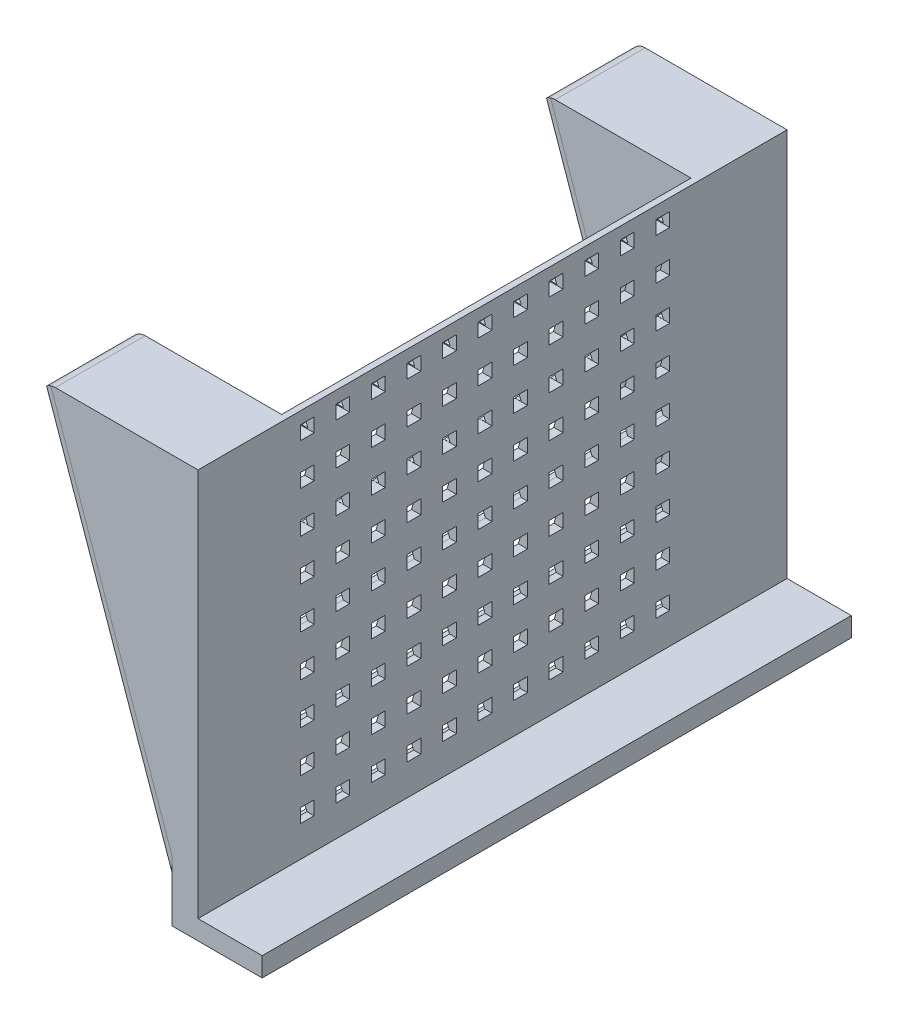
from build123d import *

# Parameters (mm, degrees)
SKETCH1_W           = 65.455015422
SKETCH1_H           = 426.283323678
BOSS_EXTRUDE1_DEPTH = 14
SKETCH2_W           = 296.283323678
SKETCH2_H           = 281.187039655
BOSS_EXTRUDE2_DEPTH = 9
CUT_EXTRUDE1_DEPTH  = 301
SKETCH4_W           = 10
SKETCH4_H           = 10
CUT_EXTRUDE2_DEPTH  = 20
BOSS_EXTRUDE3_DEPTH = 65
FILLET1_R           = 10
BOSS_EXTRUDE4_DEPTH = 65
FILLET2_R           = 10


with BuildPart() as part:
    # Sketch1 → Boss-Extrude1 (new body)
    with BuildSketch(Plane.XZ.offset(-2205.344281495)):
        with Locations((2748.549131836, 976.083854875)):
            Rectangle(SKETCH1_W, SKETCH1_H)
    extrude(amount=BOSS_EXTRUDE1_DEPTH)

    # Sketch2 → Boss-Extrude2 (add)
    with BuildSketch(Plane.ZY.offset(-2725.821624125)):
        with Locations((976.083854875, 2345.937801323)):
            Rectangle(SKETCH2_W, SKETCH2_H)
    extrude(amount=-BOSS_EXTRUDE2_DEPTH)

    # Sketch3 → Cut-Extrude1 (cut)
    with BuildSketch(Plane.XY.offset(1124.225516714)):
        Polygon((2730.321624125, 2405.73132115), (2725.821624125, 2405.73132115), (2725.821624125, 2387.691998559), (2730.321624125, 2387.691998559), (2727.297306391, 2395.09100795), align=None)
        Polygon((2730.321624125, 2425.93132115), (2725.821624125, 2425.93132115), (2725.821624125, 2407.891998559), (2730.321624125, 2407.891998559), (2727.297306391, 2415.29100795), align=None)
        Polygon((2730.321624125, 2446.13132115), (2725.821624125, 2446.13132115), (2725.821624125, 2428.091998559), (2730.321624125, 2428.091998559), (2727.297306391, 2435.49100795), align=None)
        Polygon((2730.321624125, 2466.33132115), (2725.821624125, 2466.33132115), (2725.821624125, 2448.291998559), (2730.321624125, 2448.291998559), (2727.297306391, 2455.69100795), align=None)
        Polygon((2727.297306391, 2475.89100795), (2730.321624125, 2486.53132115), (2725.821624125, 2486.53132115), (2725.821624125, 2468.491998559), (2730.321624125, 2468.491998559), align=None)
        Polygon((2730.321624125, 2385.53132115), (2725.821624125, 2385.53132115), (2725.821624125, 2367.491998559), (2730.321624125, 2367.491998559), (2727.297306391, 2374.89100795), align=None)
        Polygon((2730.321624125, 2365.33132115), (2725.821624125, 2365.33132115), (2725.821624125, 2347.291998559), (2730.321624125, 2347.291998559), (2727.297306391, 2354.69100795), align=None)
        Polygon((2730.321624125, 2345.13132115), (2725.821624125, 2345.13132115), (2725.821624125, 2327.091998559), (2730.321624125, 2327.091998559), (2727.297306391, 2334.49100795), align=None)
        Polygon((2730.321624125, 2324.93132115), (2725.821624125, 2324.93132115), (2725.821624125, 2306.891998559), (2730.321624125, 2306.891998559), (2727.297306391, 2314.29100795), align=None)
        Polygon((2730.321624125, 2304.73132115), (2725.821624125, 2304.73132115), (2725.821624125, 2286.691998559), (2730.321624125, 2286.691998559), (2727.297306391, 2294.09100795), align=None)
        Polygon((2730.321624125, 2284.53132115), (2725.821624125, 2284.53132115), (2725.821624125, 2266.491998559), (2730.321624125, 2266.491998559), (2727.297306391, 2273.89100795), align=None)
        Polygon((2730.321624125, 2264.33132115), (2725.821624125, 2264.33132115), (2725.821624125, 2246.291998559), (2730.321624125, 2246.291998559), (2727.297306391, 2253.69100795), align=None)
        Polygon((2730.321624125, 2244.13132115), (2725.821624125, 2244.13132115), (2725.821624125, 2226.091998559), (2730.321624125, 2226.091998559), (2727.297306391, 2233.49100795), align=None)
        Polygon((2730.321624125, 2223.93132115), (2725.821624125, 2223.93132115), (2725.821624125, 2205.891998559), (2730.321624125, 2205.891998559), (2727.297306391, 2213.29100795), align=None)
    extrude(amount=-CUT_EXTRUDE1_DEPTH, mode=Mode.SUBTRACT)

    # Sketch4 → Cut-Extrude2 (cut)
    with BuildSketch(Plane(origin=(2734.821624125, 0, 0), x_dir=(0, 0, -1), z_dir=(1, 0, 0))):
        with Locations((-1084.484396727, 2472.786072392)):
            Rectangle(SKETCH4_W, SKETCH4_H)
        with Locations((-1110.218258485, 2472.786072392)):
            Rectangle(SKETCH4_W, SKETCH4_H)
        with Locations((-1058.75053497, 2472.786072392)):
            Rectangle(SKETCH4_W, SKETCH4_H)
        with Locations((-1033.016673212, 2472.786072392)):
            Rectangle(SKETCH4_W, SKETCH4_H)
        with Locations((-1007.282811455, 2472.786072392)):
            Rectangle(SKETCH4_W, SKETCH4_H)
        with Locations((-981.548949697, 2472.786072392)):
            Rectangle(SKETCH4_W, SKETCH4_H)
        with Locations((-955.81508794, 2472.786072392)):
            Rectangle(SKETCH4_W, SKETCH4_H)
        with Locations((-930.081226183, 2472.786072392)):
            Rectangle(SKETCH4_W, SKETCH4_H)
        with Locations((-904.347364425, 2472.786072392)):
            Rectangle(SKETCH4_W, SKETCH4_H)
        with Locations((-878.613502668, 2472.786072392)):
            Rectangle(SKETCH4_W, SKETCH4_H)
        with Locations((-852.87964091, 2472.786072392)):
            Rectangle(SKETCH4_W, SKETCH4_H)
        with Locations((-1084.484396727, 2442.786072392)):
            Rectangle(SKETCH4_W, SKETCH4_H)
        with Locations((-1110.218258485, 2442.786072392)):
            Rectangle(SKETCH4_W, SKETCH4_H)
        with Locations((-1058.75053497, 2442.786072392)):
            Rectangle(SKETCH4_W, SKETCH4_H)
        with Locations((-1033.016673212, 2442.786072392)):
            Rectangle(SKETCH4_W, SKETCH4_H)
        with Locations((-1007.282811455, 2442.786072392)):
            Rectangle(SKETCH4_W, SKETCH4_H)
        with Locations((-981.548949697, 2442.786072392)):
            Rectangle(SKETCH4_W, SKETCH4_H)
        with Locations((-955.81508794, 2442.786072392)):
            Rectangle(SKETCH4_W, SKETCH4_H)
        with Locations((-930.081226183, 2442.786072392)):
            Rectangle(SKETCH4_W, SKETCH4_H)
        with Locations((-904.347364425, 2442.786072392)):
            Rectangle(SKETCH4_W, SKETCH4_H)
        with Locations((-878.613502668, 2442.786072392)):
            Rectangle(SKETCH4_W, SKETCH4_H)
        with Locations((-852.87964091, 2442.786072392)):
            Rectangle(SKETCH4_W, SKETCH4_H)
        with Locations((-1084.484396727, 2412.786072392)):
            Rectangle(SKETCH4_W, SKETCH4_H)
        with Locations((-1110.218258485, 2412.786072392)):
            Rectangle(SKETCH4_W, SKETCH4_H)
        with Locations((-1058.75053497, 2412.786072392)):
            Rectangle(SKETCH4_W, SKETCH4_H)
        with Locations((-1033.016673212, 2412.786072392)):
            Rectangle(SKETCH4_W, SKETCH4_H)
        with Locations((-1007.282811455, 2412.786072392)):
            Rectangle(SKETCH4_W, SKETCH4_H)
        with Locations((-981.548949697, 2412.786072392)):
            Rectangle(SKETCH4_W, SKETCH4_H)
        with Locations((-955.81508794, 2412.786072392)):
            Rectangle(SKETCH4_W, SKETCH4_H)
        with Locations((-930.081226183, 2412.786072392)):
            Rectangle(SKETCH4_W, SKETCH4_H)
        with Locations((-904.347364425, 2412.786072392)):
            Rectangle(SKETCH4_W, SKETCH4_H)
        with Locations((-878.613502668, 2412.786072392)):
            Rectangle(SKETCH4_W, SKETCH4_H)
        with Locations((-852.87964091, 2412.786072392)):
            Rectangle(SKETCH4_W, SKETCH4_H)
        with Locations((-1084.484396727, 2382.786072392)):
            Rectangle(SKETCH4_W, SKETCH4_H)
        with Locations((-1110.218258485, 2382.786072392)):
            Rectangle(SKETCH4_W, SKETCH4_H)
        with Locations((-1058.75053497, 2382.786072392)):
            Rectangle(SKETCH4_W, SKETCH4_H)
        with Locations((-1033.016673212, 2382.786072392)):
            Rectangle(SKETCH4_W, SKETCH4_H)
        with Locations((-1007.282811455, 2382.786072392)):
            Rectangle(SKETCH4_W, SKETCH4_H)
        with Locations((-981.548949697, 2382.786072392)):
            Rectangle(SKETCH4_W, SKETCH4_H)
        with Locations((-955.81508794, 2382.786072392)):
            Rectangle(SKETCH4_W, SKETCH4_H)
        with Locations((-930.081226183, 2382.786072392)):
            Rectangle(SKETCH4_W, SKETCH4_H)
        with Locations((-904.347364425, 2382.786072392)):
            Rectangle(SKETCH4_W, SKETCH4_H)
        with Locations((-878.613502668, 2382.786072392)):
            Rectangle(SKETCH4_W, SKETCH4_H)
        with Locations((-852.87964091, 2382.786072392)):
            Rectangle(SKETCH4_W, SKETCH4_H)
        with Locations((-1084.484396727, 2352.786072392)):
            Rectangle(SKETCH4_W, SKETCH4_H)
        with Locations((-1110.218258485, 2352.786072392)):
            Rectangle(SKETCH4_W, SKETCH4_H)
        with Locations((-1058.75053497, 2352.786072392)):
            Rectangle(SKETCH4_W, SKETCH4_H)
        with Locations((-1033.016673212, 2352.786072392)):
            Rectangle(SKETCH4_W, SKETCH4_H)
        with Locations((-1007.282811455, 2352.786072392)):
            Rectangle(SKETCH4_W, SKETCH4_H)
        with Locations((-981.548949697, 2352.786072392)):
            Rectangle(SKETCH4_W, SKETCH4_H)
        with Locations((-955.81508794, 2352.786072392)):
            Rectangle(SKETCH4_W, SKETCH4_H)
        with Locations((-930.081226183, 2352.786072392)):
            Rectangle(SKETCH4_W, SKETCH4_H)
        with Locations((-904.347364425, 2352.786072392)):
            Rectangle(SKETCH4_W, SKETCH4_H)
        with Locations((-878.613502668, 2352.786072392)):
            Rectangle(SKETCH4_W, SKETCH4_H)
        with Locations((-852.87964091, 2352.786072392)):
            Rectangle(SKETCH4_W, SKETCH4_H)
        with Locations((-1084.484396727, 2322.786072392)):
            Rectangle(SKETCH4_W, SKETCH4_H)
        with Locations((-1110.218258485, 2322.786072392)):
            Rectangle(SKETCH4_W, SKETCH4_H)
        with Locations((-1058.75053497, 2322.786072392)):
            Rectangle(SKETCH4_W, SKETCH4_H)
        with Locations((-1033.016673212, 2322.786072392)):
            Rectangle(SKETCH4_W, SKETCH4_H)
        with Locations((-1007.282811455, 2322.786072392)):
            Rectangle(SKETCH4_W, SKETCH4_H)
        with Locations((-981.548949697, 2322.786072392)):
            Rectangle(SKETCH4_W, SKETCH4_H)
        with Locations((-955.81508794, 2322.786072392)):
            Rectangle(SKETCH4_W, SKETCH4_H)
        with Locations((-930.081226183, 2322.786072392)):
            Rectangle(SKETCH4_W, SKETCH4_H)
        with Locations((-904.347364425, 2322.786072392)):
            Rectangle(SKETCH4_W, SKETCH4_H)
        with Locations((-878.613502668, 2322.786072392)):
            Rectangle(SKETCH4_W, SKETCH4_H)
        with Locations((-852.87964091, 2322.786072392)):
            Rectangle(SKETCH4_W, SKETCH4_H)
        with Locations((-1084.484396727, 2292.786072392)):
            Rectangle(SKETCH4_W, SKETCH4_H)
        with Locations((-1110.218258485, 2292.786072392)):
            Rectangle(SKETCH4_W, SKETCH4_H)
        with Locations((-1058.75053497, 2292.786072392)):
            Rectangle(SKETCH4_W, SKETCH4_H)
        with Locations((-1033.016673212, 2292.786072392)):
            Rectangle(SKETCH4_W, SKETCH4_H)
        with Locations((-1007.282811455, 2292.786072392)):
            Rectangle(SKETCH4_W, SKETCH4_H)
        with Locations((-981.548949697, 2292.786072392)):
            Rectangle(SKETCH4_W, SKETCH4_H)
        with Locations((-955.81508794, 2292.786072392)):
            Rectangle(SKETCH4_W, SKETCH4_H)
        with Locations((-930.081226183, 2292.786072392)):
            Rectangle(SKETCH4_W, SKETCH4_H)
        with Locations((-904.347364425, 2292.786072392)):
            Rectangle(SKETCH4_W, SKETCH4_H)
        with Locations((-878.613502668, 2292.786072392)):
            Rectangle(SKETCH4_W, SKETCH4_H)
        with Locations((-852.87964091, 2292.786072392)):
            Rectangle(SKETCH4_W, SKETCH4_H)
        with Locations((-1084.484396727, 2262.786072392)):
            Rectangle(SKETCH4_W, SKETCH4_H)
        with Locations((-1110.218258485, 2262.786072392)):
            Rectangle(SKETCH4_W, SKETCH4_H)
        with Locations((-1058.75053497, 2262.786072392)):
            Rectangle(SKETCH4_W, SKETCH4_H)
        with Locations((-1033.016673212, 2262.786072392)):
            Rectangle(SKETCH4_W, SKETCH4_H)
        with Locations((-1007.282811455, 2262.786072392)):
            Rectangle(SKETCH4_W, SKETCH4_H)
        with Locations((-981.548949697, 2262.786072392)):
            Rectangle(SKETCH4_W, SKETCH4_H)
        with Locations((-955.81508794, 2262.786072392)):
            Rectangle(SKETCH4_W, SKETCH4_H)
        with Locations((-930.081226183, 2262.786072392)):
            Rectangle(SKETCH4_W, SKETCH4_H)
        with Locations((-904.347364425, 2262.786072392)):
            Rectangle(SKETCH4_W, SKETCH4_H)
        with Locations((-878.613502668, 2262.786072392)):
            Rectangle(SKETCH4_W, SKETCH4_H)
        with Locations((-852.87964091, 2262.786072392)):
            Rectangle(SKETCH4_W, SKETCH4_H)
        with Locations((-1084.484396727, 2232.786072392)):
            Rectangle(SKETCH4_W, SKETCH4_H)
        with Locations((-1110.218258485, 2232.786072392)):
            Rectangle(SKETCH4_W, SKETCH4_H)
        with Locations((-1058.75053497, 2232.786072392)):
            Rectangle(SKETCH4_W, SKETCH4_H)
        with Locations((-1033.016673212, 2232.786072392)):
            Rectangle(SKETCH4_W, SKETCH4_H)
        with Locations((-1007.282811455, 2232.786072392)):
            Rectangle(SKETCH4_W, SKETCH4_H)
        with Locations((-981.548949697, 2232.786072392)):
            Rectangle(SKETCH4_W, SKETCH4_H)
        with Locations((-955.81508794, 2232.786072392)):
            Rectangle(SKETCH4_W, SKETCH4_H)
        with Locations((-930.081226183, 2232.786072392)):
            Rectangle(SKETCH4_W, SKETCH4_H)
        with Locations((-904.347364425, 2232.786072392)):
            Rectangle(SKETCH4_W, SKETCH4_H)
        with Locations((-878.613502668, 2232.786072392)):
            Rectangle(SKETCH4_W, SKETCH4_H)
        with Locations((-852.87964091, 2232.786072392)):
            Rectangle(SKETCH4_W, SKETCH4_H)
    extrude(amount=-CUT_EXTRUDE2_DEPTH, mode=Mode.SUBTRACT)

    # Sketch5 → Boss-Extrude3 (add)
    with BuildSketch(Plane.XY.offset(1124.225516714)):
        Polygon((2734.821624125, 2486.53132115), (2734.821624125, 2205.344281495), (2715.821624125, 2205.344281495), (2617.550474141, 2486.53132115), align=None)
    extrude(amount=BOSS_EXTRUDE3_DEPTH)

    # Fillet1
    # the kernel refuses this fillet: 10 mm, written as the material it takes off along each edge
    with BuildSketch(Plane(origin=(2724.069593349, 2181.744048367, 1189.225516714), x_dir=(0.9440093251022348, 0.3299187689720354, -4.547473508864564e-14), z_dir=(-0.3299187689720354, 0.9440093251022348, 0))) as fillet1_piece_1_section:
        with BuildLine():
            CenterArc((FILLET1_R, FILLET1_R), FILLET1_R, 180, 90)
            Line((0, FILLET1_R), (0, 0))
            Line((0, 0), (FILLET1_R, 0))
        make_face()
    fillet1_piece_1 = extrude(amount=347.86468436, mode=Mode.PRIVATE)
    fillet1_piece_1 = split(fillet1_piece_1, bisect_by=Plane(origin=(2715.821624125, 2181.744048367, 1189.225516714), z_dir=(-1, 0, 0)), keep=Keep.TOP, mode=Mode.PRIVATE)
    add(fillet1_piece_1, mode=Mode.SUBTRACT)
    with BuildSketch(Plane(origin=(2724.069593349, 2181.744048367, 1124.225516714), x_dir=(0, 0, 1), z_dir=(-0.3299187689720354, 0.9440093251022348, 0))) as fillet1_piece_2_section:
        with BuildLine():
            CenterArc((FILLET1_R, FILLET1_R), FILLET1_R, 180, 90)
            Line((0, FILLET1_R), (0, 0))
            Line((0, 0), (FILLET1_R, 0))
        make_face()
    fillet1_piece_2 = extrude(amount=347.86468436, mode=Mode.PRIVATE)
    fillet1_piece_2 = split(fillet1_piece_2, bisect_by=Plane(origin=(2715.821624125, 2181.744048367, 1124.225516714), z_dir=(1, 0, 0)), keep=Keep.TOP, mode=Mode.PRIVATE)
    fillet1_piece_2 = split(fillet1_piece_2, bisect_by=Plane(origin=(2725.821624125, 2181.744048367, 1124.225516714), z_dir=(-1, 0, 0)), keep=Keep.TOP, mode=Mode.PRIVATE)
    fillet1_piece_2 = split(fillet1_piece_2, bisect_by=Plane(origin=(2724.069593349, 2205.891998559, 1124.225516714), z_dir=(0, -1, 0)), keep=Keep.TOP, mode=Mode.PRIVATE)
    fillet1_piece_2 = split(fillet1_piece_2, bisect_by=Plane(origin=(2724.069593349, 2205.344281495, 1124.225516714), z_dir=(0, 1, 0)), keep=Keep.TOP, mode=Mode.PRIVATE)
    add(fillet1_piece_2, mode=Mode.SUBTRACT)
    with BuildSketch(Plane(origin=(2724.069593349, 2181.744048367, 1124.225516714), x_dir=(0, 0, 1), z_dir=(-0.3299187689720354, 0.9440093251022348, 0))) as fillet1_piece_3_section:
        with BuildLine():
            CenterArc((FILLET1_R, FILLET1_R), FILLET1_R, 180, 90)
            Line((0, FILLET1_R), (0, 0))
            Line((0, 0), (FILLET1_R, 0))
        make_face()
    fillet1_piece_3 = extrude(amount=347.86468436, mode=Mode.PRIVATE)
    fillet1_piece_3 = split(fillet1_piece_3, bisect_by=Plane(origin=(2715.821624125, 2181.744048367, 1124.225516714), z_dir=(1, 0, 0)), keep=Keep.TOP, mode=Mode.PRIVATE)
    fillet1_piece_3 = split(fillet1_piece_3, bisect_by=Plane(origin=(2725.821624125, 2181.744048367, 1124.225516714), z_dir=(-1, 0, 0)), keep=Keep.TOP, mode=Mode.PRIVATE)
    fillet1_piece_3 = split(fillet1_piece_3, bisect_by=Plane(origin=(2724.069593349, 2205.891998559, 1124.225516714), z_dir=(0, 1, 0)), keep=Keep.TOP, mode=Mode.PRIVATE)
    add(fillet1_piece_3, mode=Mode.SUBTRACT)
    with BuildSketch(Plane(origin=(2724.069593349, 2181.744048367, 1124.225516714), x_dir=(0, 0, 1), z_dir=(-0.3299187689720354, 0.9440093251022348, 0))) as fillet1_piece_4_section:
        with BuildLine():
            CenterArc((FILLET1_R, FILLET1_R), FILLET1_R, 180, 90)
            Line((0, FILLET1_R), (0, 0))
            Line((0, 0), (FILLET1_R, 0))
        make_face()
    fillet1_piece_4 = extrude(amount=347.86468436, mode=Mode.PRIVATE)
    fillet1_piece_4 = split(fillet1_piece_4, bisect_by=Plane(origin=(2715.821624125, 2181.744048367, 1124.225516714), z_dir=(-1, 0, 0)), keep=Keep.TOP, mode=Mode.PRIVATE)
    fillet1_piece_4 = split(fillet1_piece_4, bisect_by=Plane(origin=(2724.069593349, 2205.891998559, 1124.225516714), z_dir=(0, -1, 0)), keep=Keep.TOP, mode=Mode.PRIVATE)
    fillet1_piece_4 = split(fillet1_piece_4, bisect_by=Plane(origin=(2724.069593349, 2205.344281495, 1124.225516714), z_dir=(0, 1, 0)), keep=Keep.TOP, mode=Mode.PRIVATE)
    add(fillet1_piece_4, mode=Mode.SUBTRACT)
    with BuildSketch(Plane(origin=(2724.069593349, 2181.744048367, 1124.225516714), x_dir=(0, 0, 1), z_dir=(-0.3299187689720354, 0.9440093251022348, 0))) as fillet1_piece_5_section:
        with BuildLine():
            CenterArc((FILLET1_R, FILLET1_R), FILLET1_R, 180, 90)
            Line((0, FILLET1_R), (0, 0))
            Line((0, 0), (FILLET1_R, 0))
        make_face()
    fillet1_piece_5 = extrude(amount=347.86468436, mode=Mode.PRIVATE)
    fillet1_piece_5 = split(fillet1_piece_5, bisect_by=Plane(origin=(2725.821624125, 2181.744048367, 1124.225516714), z_dir=(1, 0, 0)), keep=Keep.TOP, mode=Mode.PRIVATE)
    fillet1_piece_5 = split(fillet1_piece_5, bisect_by=Plane(origin=(2724.069593349, 2205.891998559, 1124.225516714), z_dir=(0, 1, 0)), keep=Keep.TOP, mode=Mode.PRIVATE)
    add(fillet1_piece_5, mode=Mode.SUBTRACT)
    with BuildSketch(Plane(origin=(2724.069593349, 2181.744048367, 1124.225516714), x_dir=(0, 0, 1), z_dir=(-0.3299187689720354, 0.9440093251022348, 0))) as fillet1_piece_6_section:
        with BuildLine():
            CenterArc((FILLET1_R, FILLET1_R), FILLET1_R, 180, 90)
            Line((0, FILLET1_R), (0, 0))
            Line((0, 0), (FILLET1_R, 0))
        make_face()
    fillet1_piece_6 = extrude(amount=347.86468436, mode=Mode.PRIVATE)
    fillet1_piece_6 = split(fillet1_piece_6, bisect_by=Plane(origin=(2715.821624125, 2181.744048367, 1124.225516714), z_dir=(-1, 0, 0)), keep=Keep.TOP, mode=Mode.PRIVATE)
    fillet1_piece_6 = split(fillet1_piece_6, bisect_by=Plane(origin=(2724.069593349, 2205.891998559, 1124.225516714), z_dir=(0, 1, 0)), keep=Keep.TOP, mode=Mode.PRIVATE)
    add(fillet1_piece_6, mode=Mode.SUBTRACT)
    with BuildSketch(Plane(origin=(2617.550474141, 2486.53132115, 1089.005558245), x_dir=(0.3299187689720272, -0.9440093251022377, 0), z_dir=(0, 0, 1))) as fillet1_piece_7:
        with BuildLine():
            CenterArc((FILLET1_R * 1.40879833875, FILLET1_R), FILLET1_R, 160.736154825, 109.263845175)
            Line((FILLET1_R * 0.464789013651, FILLET1_R * 1.32991876897), (0, 0))
            Line((0, 0), (FILLET1_R * 1.40879833875, 0))
        make_face()
    extrude(amount=135.439916938, mode=Mode.SUBTRACT)

    # Sketch6 → Boss-Extrude4 (add)
    with BuildSketch(Plane(origin=(0, 0, 827.942193036), x_dir=(-1, 0, 0), z_dir=(0, 0, -1))):
        Polygon((-2734.821624125, 2486.53132115), (-2617.999143342, 2486.53132115), (-2715.821624125, 2205.344281495), (-2734.821624125, 2205.344281495), align=None)
    extrude(amount=BOSS_EXTRUDE4_DEPTH)

    # Fillet2
    # the kernel refuses this fillet: 10 mm, written as the material it takes off along each edge
    with BuildSketch(Plane(origin=(2609.784757406, 2510.143264392, 827.942193036), x_dir=(0, 0, -1), z_dir=(0.32857543746210777, -0.9444777296985803, 0))) as fillet2_piece_1_section:
        with BuildLine():
            CenterArc((FILLET2_R, FILLET2_R), FILLET2_R, 180, 90)
            Line((0, FILLET2_R), (0, 0))
            Line((0, 0), (FILLET2_R, 0))
        make_face()
    fillet2_piece_1 = extrude(amount=347.71696125, mode=Mode.PRIVATE)
    fillet2_piece_1 = split(fillet2_piece_1, bisect_by=Plane(origin=(2715.821624125, 2510.143264392, 827.942193036), z_dir=(-1, 0, 0)), keep=Keep.TOP, mode=Mode.PRIVATE)
    fillet2_piece_1 = split(fillet2_piece_1, bisect_by=Plane(origin=(2609.784757406, 2205.891998559, 827.942193036), z_dir=(0, 1, 0)), keep=Keep.TOP, mode=Mode.PRIVATE)
    add(fillet2_piece_1, mode=Mode.SUBTRACT)
    with BuildSketch(Plane(origin=(2609.784757406, 2510.143264392, 827.942193036), x_dir=(0, 0, -1), z_dir=(0.32857543746210777, -0.9444777296985803, 0))) as fillet2_piece_2_section:
        with BuildLine():
            CenterArc((FILLET2_R, FILLET2_R), FILLET2_R, 180, 90)
            Line((0, FILLET2_R), (0, 0))
            Line((0, 0), (FILLET2_R, 0))
        make_face()
    fillet2_piece_2 = extrude(amount=347.71696125, mode=Mode.PRIVATE)
    fillet2_piece_2 = split(fillet2_piece_2, bisect_by=Plane(origin=(2715.821624125, 2510.143264392, 827.942193036), z_dir=(1, 0, 0)), keep=Keep.TOP, mode=Mode.PRIVATE)
    fillet2_piece_2 = split(fillet2_piece_2, bisect_by=Plane(origin=(2609.784757406, 2205.891998559, 827.942193036), z_dir=(0, 1, 0)), keep=Keep.TOP, mode=Mode.PRIVATE)
    fillet2_piece_2 = split(fillet2_piece_2, bisect_by=Plane(origin=(2725.821624125, 2510.143264392, 827.942193036), z_dir=(-1, 0, 0)), keep=Keep.TOP, mode=Mode.PRIVATE)
    add(fillet2_piece_2, mode=Mode.SUBTRACT)
    with BuildSketch(Plane(origin=(2609.784757406, 2510.143264392, 827.942193036), x_dir=(0, 0, -1), z_dir=(0.32857543746210777, -0.9444777296985803, 0))) as fillet2_piece_3_section:
        with BuildLine():
            CenterArc((FILLET2_R, FILLET2_R), FILLET2_R, 180, 90)
            Line((0, FILLET2_R), (0, 0))
            Line((0, 0), (FILLET2_R, 0))
        make_face()
    fillet2_piece_3 = extrude(amount=347.71696125, mode=Mode.PRIVATE)
    fillet2_piece_3 = split(fillet2_piece_3, bisect_by=Plane(origin=(2715.821624125, 2510.143264392, 827.942193036), z_dir=(-1, 0, 0)), keep=Keep.TOP, mode=Mode.PRIVATE)
    fillet2_piece_3 = split(fillet2_piece_3, bisect_by=Plane(origin=(2609.784757406, 2205.891998559, 827.942193036), z_dir=(0, -1, 0)), keep=Keep.TOP, mode=Mode.PRIVATE)
    fillet2_piece_3 = split(fillet2_piece_3, bisect_by=Plane(origin=(2609.784757406, 2205.344281495, 827.942193036), z_dir=(0, 1, 0)), keep=Keep.TOP, mode=Mode.PRIVATE)
    add(fillet2_piece_3, mode=Mode.SUBTRACT)
    with BuildSketch(Plane(origin=(2609.784757406, 2510.143264392, 827.942193036), x_dir=(0, 0, -1), z_dir=(0.32857543746210777, -0.9444777296985803, 0))) as fillet2_piece_4_section:
        with BuildLine():
            CenterArc((FILLET2_R, FILLET2_R), FILLET2_R, 180, 90)
            Line((0, FILLET2_R), (0, 0))
            Line((0, 0), (FILLET2_R, 0))
        make_face()
    fillet2_piece_4 = extrude(amount=347.71696125, mode=Mode.PRIVATE)
    fillet2_piece_4 = split(fillet2_piece_4, bisect_by=Plane(origin=(2609.784757406, 2205.891998559, 827.942193036), z_dir=(0, 1, 0)), keep=Keep.TOP, mode=Mode.PRIVATE)
    fillet2_piece_4 = split(fillet2_piece_4, bisect_by=Plane(origin=(2725.821624125, 2510.143264392, 827.942193036), z_dir=(1, 0, 0)), keep=Keep.TOP, mode=Mode.PRIVATE)
    add(fillet2_piece_4, mode=Mode.SUBTRACT)
    with BuildSketch(Plane(origin=(2609.784757406, 2510.143264392, 827.942193036), x_dir=(0, 0, -1), z_dir=(0.32857543746210777, -0.9444777296985803, 0))) as fillet2_piece_5_section:
        with BuildLine():
            CenterArc((FILLET2_R, FILLET2_R), FILLET2_R, 180, 90)
            Line((0, FILLET2_R), (0, 0))
            Line((0, 0), (FILLET2_R, 0))
        make_face()
    fillet2_piece_5 = extrude(amount=347.71696125, mode=Mode.PRIVATE)
    fillet2_piece_5 = split(fillet2_piece_5, bisect_by=Plane(origin=(2715.821624125, 2510.143264392, 827.942193036), z_dir=(1, 0, 0)), keep=Keep.TOP, mode=Mode.PRIVATE)
    fillet2_piece_5 = split(fillet2_piece_5, bisect_by=Plane(origin=(2609.784757406, 2205.891998559, 827.942193036), z_dir=(0, -1, 0)), keep=Keep.TOP, mode=Mode.PRIVATE)
    fillet2_piece_5 = split(fillet2_piece_5, bisect_by=Plane(origin=(2725.821624125, 2510.143264392, 827.942193036), z_dir=(-1, 0, 0)), keep=Keep.TOP, mode=Mode.PRIVATE)
    fillet2_piece_5 = split(fillet2_piece_5, bisect_by=Plane(origin=(2609.784757406, 2205.344281495, 827.942193036), z_dir=(0, 1, 0)), keep=Keep.TOP, mode=Mode.PRIVATE)
    add(fillet2_piece_5, mode=Mode.SUBTRACT)
    with BuildSketch(Plane(origin=(2609.784757406, 2510.143264392, 762.942193036), x_dir=(0.9444777296985803, 0.3285754374621077, -4.547473508864671e-14), z_dir=(0.32857543746210777, -0.9444777296985803, 0))) as fillet2_piece_6_section:
        with BuildLine():
            CenterArc((FILLET2_R, FILLET2_R), FILLET2_R, 180, 90)
            Line((0, FILLET2_R), (0, 0))
            Line((0, 0), (FILLET2_R, 0))
        make_face()
    fillet2_piece_6 = extrude(amount=347.71696125, mode=Mode.PRIVATE)
    fillet2_piece_6 = split(fillet2_piece_6, bisect_by=Plane(origin=(2715.821624125, 2510.143264392, 762.942193036), z_dir=(-1, 0, 0)), keep=Keep.TOP, mode=Mode.PRIVATE)
    add(fillet2_piece_6, mode=Mode.SUBTRACT)
    with BuildSketch(Plane(origin=(2617.999143342, 2486.53132115, 863.109126985), x_dir=(0.3285754374621084, -0.9444777296985801, 0), z_dir=(0, 0, -1))) as fillet2_piece_7:
        with BuildLine():
            CenterArc((FILLET2_R * 1.40667735796, -FILLET2_R), FILLET2_R, 90, 109.182333138)
            Line((FILLET2_R * 0.462199628259, -FILLET2_R * 1.32857543746), (0, 0))
            Line((0, 0), (FILLET2_R * 1.40667735796, 0))
        make_face()
    extrude(amount=135.333867898, mode=Mode.SUBTRACT)


solid = part.part
